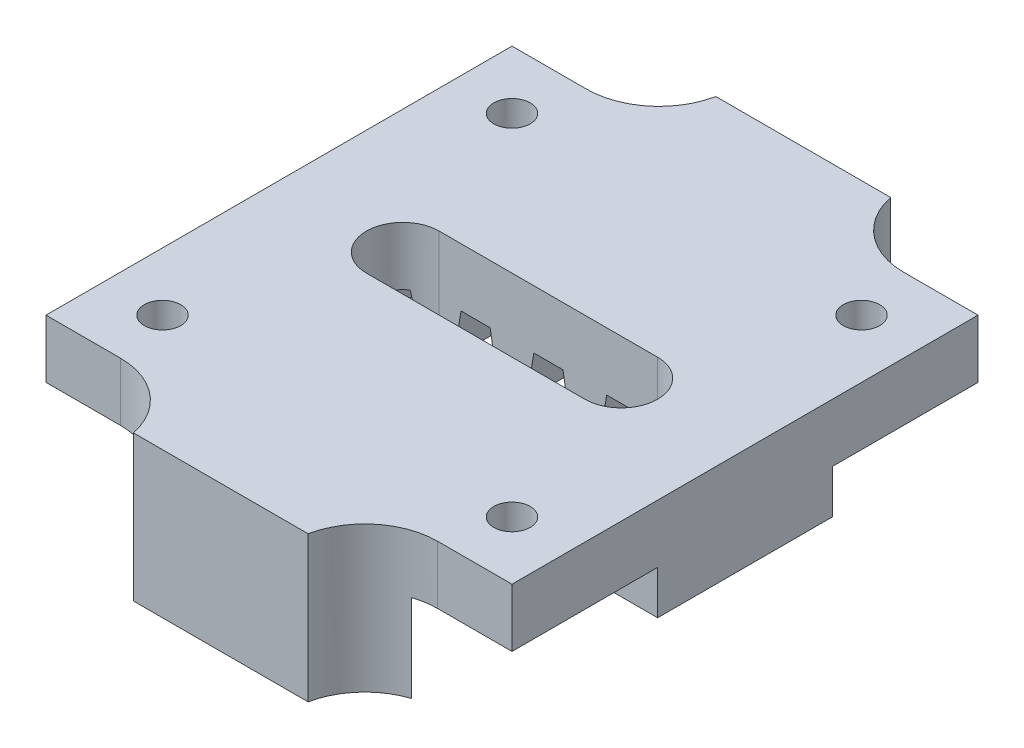
from build123d import *

# Parameters (mm, degrees)
SKETCH_1_W                      = 32
SKETCH_1_H                      = 32
EXTRUDE_1_DEPTH                 = 7
SKETCH_3_R                      = 1.25
CUT_EXTRUDE_1_DEPTH             = 46.793012567
CUT_EXTRUDE_2_DEPTH             = 3
CUT_EXTRUDE_3_DEPTH             = 46.793012567
SKETCH_6_W                      = 12
SKETCH_6_H                      = 10
EXTRUDE_2_DEPTH                 = 4
SKETCH_11_W                     = 12
SKETCH_11_H                     = 3
CUT_EXTRUDE_5_DEPTH             = 0.25
SKETCH_12_W                     = 12
SKETCH_12_H                     = 3
CUT_EXTRUDE_6_DEPTH             = 0.25
CUT_EXTRUDE_7_REACH             = 40.38
CUT_EXTRUDE_7_DIRECTION_2_REACH = 40.38
FILLET_1_R                      = 5
FILLET_2_R                      = 5
CUT_EXTRUDE_8_REACH             = 50.672
SKETCH_13_W                     = 10
SKETCH_13_H                     = 3
CUT_EXTRUDE_9_REACH             = 50.672
SKETCH_14_W                     = 10
SKETCH_14_H                     = 3


with BuildPart() as part:
    # Эскиз1 → Бобышка-Вытянуть1 (new body)
    with BuildSketch(Plane(origin=(0, 0, 0), x_dir=(1, 0, 0), z_dir=(0, 1, 0))):
        with Locations((16, 16)):
            Rectangle(SKETCH_1_W, SKETCH_1_H)
    extrude(amount=EXTRUDE_1_DEPTH)

    # Эскиз3 → Вырез-Вытянуть1 (cut, through all)
    with BuildSketch(Plane(origin=(0, 7, 0), x_dir=(1, 0, 0), z_dir=(0, 1, 0))):
        with Locations(Location((4, 28, 0), (0, 0, 270))):
            Circle(SKETCH_3_R)
        with Locations(Location((28, 28, 0), (0, 0, 270))):
            Circle(SKETCH_3_R)
        with Locations(Location((4, 4, 0), (0, 0, 270))):
            Circle(SKETCH_3_R)
        with Locations(Location((28, 4, 0), (0, 0, 270))):
            Circle(SKETCH_3_R)
    extrude(amount=-CUT_EXTRUDE_1_DEPTH, mode=Mode.SUBTRACT)

    # Эскиз4 → Вырез-Вытянуть2 (cut)
    with BuildSketch(Plane.XZ):
        with BuildLine():
            Line((28, -10), (32, -10))
            Line((32, -10), (32, 0))
            Line((32, 0), (22, 0))
            Line((22, 0), (22, -4))
            ThreePointArc((22, -4), (23.757359313, -8.242640687), (28, -10))
        make_face()
        with BuildLine():
            Line((4, -10), (0, -10))
            Line((0, -10), (0, 0))
            Line((0, 0), (10, 0))
            Line((10, 0), (10, -4))
            ThreePointArc((10, -4), (8.242640687, -8.242640687), (4, -10))
        make_face()
        with BuildLine():
            Line((22, -32), (32, -32))
            Line((32, -32), (32, -22))
            Line((32, -22), (28, -22))
            ThreePointArc((28, -22), (23.757359313, -23.757359313), (22, -28))
            Line((22, -28), (22, -32))
        make_face()
        with BuildLine():
            Line((10, -32), (0, -32))
            Line((0, -32), (0, -22))
            Line((0, -22), (4, -22))
            ThreePointArc((4, -22), (8.242640687, -23.757359313), (10, -28))
            Line((10, -28), (10, -32))
        make_face()
    extrude(amount=-CUT_EXTRUDE_2_DEPTH, mode=Mode.SUBTRACT)

    # Эскиз5 → Вырез-Вытянуть3 (cut, through all)
    with BuildSketch(Plane(origin=(0, 7, 0), x_dir=(1, 0, 0), z_dir=(0, 1, 0))):
        with BuildLine():
            Line((23.5, 18.5), (8.5, 18.5))
            ThreePointArc((8.5, 18.5), (6, 16), (8.5, 13.5))
            Line((8.5, 13.5), (23.5, 13.5))
            ThreePointArc((23.5, 13.5), (26, 16), (23.5, 18.5))
        make_face()
    extrude(amount=-CUT_EXTRUDE_3_DEPTH, mode=Mode.SUBTRACT)

    # Эскиз6 → Бобышка-Вытянуть2 (add)
    with BuildSketch(Plane.XY):
        with Locations((16, 2)):
            Rectangle(SKETCH_6_W, SKETCH_6_H)
    extrude_2 = extrude(amount=EXTRUDE_2_DEPTH)

    # Зеркальное отражение1: Бобышка-Вытянуть2 across plane
    add(extrude_2.mirror(Plane(origin=(0, 0, -16), x_dir=(1, 0, 0), z_dir=(0, 0, -1))))

    # Эскиз11 → Вырез-Вытянуть5 (cut)
    with BuildSketch(Plane(origin=(0, 0, 0), x_dir=(-1, 0, 0), z_dir=(0, 0, -1))):
        with Locations((-16, -1.5)):
            Rectangle(SKETCH_11_W, SKETCH_11_H)
    extrude(amount=-CUT_EXTRUDE_5_DEPTH, mode=Mode.SUBTRACT)

    # Эскиз12 → Вырез-Вытянуть6 (cut)
    with BuildSketch(Plane.XY.offset(-32)):
        with Locations((16, -1.5)):
            Rectangle(SKETCH_12_W, SKETCH_12_H)
    extrude(amount=-CUT_EXTRUDE_6_DEPTH, mode=Mode.SUBTRACT)

    # Вырез-Вытянуть7: up to this face of the body (flat: up to its plane)
    cut_extrude_7_end = Plane(part.part.faces().sort_by_distance((16, -1.5, 0.25))[0])
    # Эскиз10 → Вырез-Вытянуть7 (cut, up to the picked face)
    with BuildSketch(Plane(origin=(0, 0, -16), x_dir=(-1, 0, 0), z_dir=(0, 0, -1)), mode=Mode.PRIVATE) as cut_extrude_7_sk1:
        Polygon((-14.5, 0), (-15, 3), (-17, 3), (-17.5, 0), align=None)
    cut_extrude_7_tool1 = split(extrude(cut_extrude_7_sk1.sketch, amount=-CUT_EXTRUDE_7_REACH, mode=Mode.PRIVATE), bisect_by=cut_extrude_7_end, keep=Keep.BOTH, mode=Mode.PRIVATE)
    # Эскиз10 → Вырез-Вытянуть7 (cut, up to the picked face)
    with BuildSketch(Plane(origin=(0, 0, -16), x_dir=(-1, 0, 0), z_dir=(0, 0, -1)), mode=Mode.PRIVATE) as cut_extrude_7_sk2:
        Polygon((-9.5, 0), (-10, 3), (-12, 3), (-12.5, 0), align=None)
    cut_extrude_7_tool2 = split(extrude(cut_extrude_7_sk2.sketch, amount=-CUT_EXTRUDE_7_REACH, mode=Mode.PRIVATE), bisect_by=cut_extrude_7_end, keep=Keep.BOTH, mode=Mode.PRIVATE)
    # Эскиз10 → Вырез-Вытянуть7 (cut, up to the picked face)
    with BuildSketch(Plane(origin=(0, 0, -16), x_dir=(-1, 0, 0), z_dir=(0, 0, -1)), mode=Mode.PRIVATE) as cut_extrude_7_sk3:
        Polygon((-4.5, 0), (-5, 3), (-7, 3), (-7.5, 0), align=None)
    cut_extrude_7_tool3 = split(extrude(cut_extrude_7_sk3.sketch, amount=-CUT_EXTRUDE_7_REACH, mode=Mode.PRIVATE), bisect_by=cut_extrude_7_end, keep=Keep.BOTH, mode=Mode.PRIVATE)
    # Эскиз10 → Вырез-Вытянуть7 (cut, up to the picked face)
    with BuildSketch(Plane(origin=(0, 0, -16), x_dir=(-1, 0, 0), z_dir=(0, 0, -1)), mode=Mode.PRIVATE) as cut_extrude_7_sk4:
        Polygon((-22.5, 0), (-22, 3), (-20, 3), (-19.5, 0), align=None)
    cut_extrude_7_tool4 = split(extrude(cut_extrude_7_sk4.sketch, amount=-CUT_EXTRUDE_7_REACH, mode=Mode.PRIVATE), bisect_by=cut_extrude_7_end, keep=Keep.BOTH, mode=Mode.PRIVATE)
    # Эскиз10 → Вырез-Вытянуть7 (cut, up to the picked face)
    with BuildSketch(Plane(origin=(0, 0, -16), x_dir=(-1, 0, 0), z_dir=(0, 0, -1)), mode=Mode.PRIVATE) as cut_extrude_7_sk5:
        Polygon((-27.5, 0), (-27, 3), (-25, 3), (-24.5, 0), align=None)
    cut_extrude_7_tool5 = split(extrude(cut_extrude_7_sk5.sketch, amount=-CUT_EXTRUDE_7_REACH, mode=Mode.PRIVATE), bisect_by=cut_extrude_7_end, keep=Keep.BOTH, mode=Mode.PRIVATE)
    add(cut_extrude_7_tool1.solids().sort_by(Axis((16, 1.4, -16), (0, 0, 1)))[0], mode=Mode.SUBTRACT)
    add(cut_extrude_7_tool2.solids().sort_by(Axis((11, 1.4, -16), (0, 0, 1)))[0], mode=Mode.SUBTRACT)
    add(cut_extrude_7_tool3.solids().sort_by(Axis((6, 1.4, -16), (0, 0, 1)))[0], mode=Mode.SUBTRACT)
    add(cut_extrude_7_tool4.solids().sort_by(Axis((21, 1.4, -16), (0, 0, 1)))[0], mode=Mode.SUBTRACT)
    add(cut_extrude_7_tool5.solids().sort_by(Axis((26, 1.4, -16), (0, 0, 1)))[0], mode=Mode.SUBTRACT)

    # Вырез-Вытянуть7 direction 2: up to this face of the body (flat: up to its plane)
    cut_extrude_7_direction_2_end = Plane(part.part.faces().sort_by_distance((16, -1.5, -32.25))[0])
    # Эскиз10 → Вырез-Вытянуть7 direction 2 (cut, up to the picked face)
    with BuildSketch(Plane(origin=(0, 0, -16), x_dir=(-1, 0, 0), z_dir=(0, 0, -1)), mode=Mode.PRIVATE) as cut_extrude_7_direction_2_sk1:
        Polygon((-14.5, 0), (-15, 3), (-17, 3), (-17.5, 0), align=None)
    cut_extrude_7_direction_2_tool1 = split(extrude(cut_extrude_7_direction_2_sk1.sketch, amount=CUT_EXTRUDE_7_DIRECTION_2_REACH, mode=Mode.PRIVATE), bisect_by=cut_extrude_7_direction_2_end, keep=Keep.BOTH, mode=Mode.PRIVATE)
    # Эскиз10 → Вырез-Вытянуть7 direction 2 (cut, up to the picked face)
    with BuildSketch(Plane(origin=(0, 0, -16), x_dir=(-1, 0, 0), z_dir=(0, 0, -1)), mode=Mode.PRIVATE) as cut_extrude_7_direction_2_sk2:
        Polygon((-9.5, 0), (-10, 3), (-12, 3), (-12.5, 0), align=None)
    cut_extrude_7_direction_2_tool2 = split(extrude(cut_extrude_7_direction_2_sk2.sketch, amount=CUT_EXTRUDE_7_DIRECTION_2_REACH, mode=Mode.PRIVATE), bisect_by=cut_extrude_7_direction_2_end, keep=Keep.BOTH, mode=Mode.PRIVATE)
    # Эскиз10 → Вырез-Вытянуть7 direction 2 (cut, up to the picked face)
    with BuildSketch(Plane(origin=(0, 0, -16), x_dir=(-1, 0, 0), z_dir=(0, 0, -1)), mode=Mode.PRIVATE) as cut_extrude_7_direction_2_sk3:
        Polygon((-4.5, 0), (-5, 3), (-7, 3), (-7.5, 0), align=None)
    cut_extrude_7_direction_2_tool3 = split(extrude(cut_extrude_7_direction_2_sk3.sketch, amount=CUT_EXTRUDE_7_DIRECTION_2_REACH, mode=Mode.PRIVATE), bisect_by=cut_extrude_7_direction_2_end, keep=Keep.BOTH, mode=Mode.PRIVATE)
    # Эскиз10 → Вырез-Вытянуть7 direction 2 (cut, up to the picked face)
    with BuildSketch(Plane(origin=(0, 0, -16), x_dir=(-1, 0, 0), z_dir=(0, 0, -1)), mode=Mode.PRIVATE) as cut_extrude_7_direction_2_sk4:
        Polygon((-22.5, 0), (-22, 3), (-20, 3), (-19.5, 0), align=None)
    cut_extrude_7_direction_2_tool4 = split(extrude(cut_extrude_7_direction_2_sk4.sketch, amount=CUT_EXTRUDE_7_DIRECTION_2_REACH, mode=Mode.PRIVATE), bisect_by=cut_extrude_7_direction_2_end, keep=Keep.BOTH, mode=Mode.PRIVATE)
    # Эскиз10 → Вырез-Вытянуть7 direction 2 (cut, up to the picked face)
    with BuildSketch(Plane(origin=(0, 0, -16), x_dir=(-1, 0, 0), z_dir=(0, 0, -1)), mode=Mode.PRIVATE) as cut_extrude_7_direction_2_sk5:
        Polygon((-27.5, 0), (-27, 3), (-25, 3), (-24.5, 0), align=None)
    cut_extrude_7_direction_2_tool5 = split(extrude(cut_extrude_7_direction_2_sk5.sketch, amount=CUT_EXTRUDE_7_DIRECTION_2_REACH, mode=Mode.PRIVATE), bisect_by=cut_extrude_7_direction_2_end, keep=Keep.BOTH, mode=Mode.PRIVATE)
    add(cut_extrude_7_direction_2_tool1.solids().sort_by(Axis((16, 1.4, -16), (0, 0, -1)))[0], mode=Mode.SUBTRACT)
    add(cut_extrude_7_direction_2_tool2.solids().sort_by(Axis((11, 1.4, -16), (0, 0, -1)))[0], mode=Mode.SUBTRACT)
    add(cut_extrude_7_direction_2_tool3.solids().sort_by(Axis((6, 1.4, -16), (0, 0, -1)))[0], mode=Mode.SUBTRACT)
    add(cut_extrude_7_direction_2_tool4.solids().sort_by(Axis((21, 1.4, -16), (0, 0, -1)))[0], mode=Mode.SUBTRACT)
    add(cut_extrude_7_direction_2_tool5.solids().sort_by(Axis((26, 1.4, -16), (0, 0, -1)))[0], mode=Mode.SUBTRACT)

    # Скругление1
    # the kernel refuses this fillet: 5 mm, written as the material it adds along each edge
    with BuildSketch(Plane(origin=(10, -9.247448714, 0), x_dir=(-1, 0, 0), z_dir=(0, 1, 0))) as fillet_1_piece_1_section:
        with BuildLine():
            CenterArc((4.898979486, 5), FILLET_1_R, 191.536959033, 78.463040967)
            Line((0, 4), (-0.09797959, 3.98))
            ThreePointArc((-0.09797959, 3.98), (-0.1, 2), (-0.1, 0))
            Line((-0.1, 0), (0, -0.1))
            Line((0, -0.1), (4.898979486, -0.1))
            Line((4.898979486, -0.1), (4.898979486, 0))
        make_face()
    fillet_1_piece_1 = extrude(amount=16.247448714, mode=Mode.PRIVATE)
    fillet_1_piece_1 = split(fillet_1_piece_1, bisect_by=Plane(origin=(9.174108799, 3, 1.317726135), z_dir=(0, -1, 0)), keep=Keep.TOP, mode=Mode.PRIVATE)
    fillet_1_piece_1 = split(fillet_1_piece_1, bisect_by=Plane(origin=(9.174108799, 0, 0.25), z_dir=(0, 0, 1)), keep=Keep.TOP, mode=Mode.PRIVATE)
    fillet_1_piece_1 = split(fillet_1_piece_1, bisect_by=Plane(origin=(9.174108799, -3, 1.317726135), z_dir=(0, 1, 0)), keep=Keep.TOP, mode=Mode.PRIVATE)
    add(fillet_1_piece_1)
    with BuildSketch(Plane(origin=(10, 3, 0), x_dir=(-1, 0, 0), z_dir=(0, 1, 0))) as fillet_1_piece_2_section:
        with BuildLine():
            CenterArc((4.898979486, 5), FILLET_1_R, 191.536959033, 78.463040967)
            Line((0, 4), (-0.09797959, 3.98))
            ThreePointArc((-0.09797959, 3.98), (-0.1, 2), (-0.1, 0))
            Line((-0.1, 0), (0, -0.1))
            Line((0, -0.1), (4.898979486, -0.1))
            Line((4.898979486, -0.1), (4.898979486, 0))
        make_face()
    fillet_1_piece_2 = extrude(amount=4, mode=Mode.PRIVATE)
    fillet_1_piece_2 = split(fillet_1_piece_2, bisect_by=Plane(origin=(7.929392112, 5, 0.25), z_dir=(0, 0, -1)), keep=Keep.TOP, mode=Mode.PRIVATE)
    add(fillet_1_piece_2)
    with BuildSketch(Plane(origin=(10, 3, 0), x_dir=(-1, 0, 0), z_dir=(0, 1, 0))) as fillet_1_piece_3_section:
        with BuildLine():
            CenterArc((4.898979486, 5), FILLET_1_R, 191.536959033, 78.463040967)
            Line((0, 4), (-0.09797959, 3.98))
            ThreePointArc((-0.09797959, 3.98), (-0.1, 2), (-0.1, 0))
            Line((-0.1, 0), (0, -0.1))
            Line((0, -0.1), (4.898979486, -0.1))
            Line((4.898979486, -0.1), (4.898979486, 0))
        make_face()
    fillet_1_piece_3 = extrude(amount=4, mode=Mode.PRIVATE)
    fillet_1_piece_3 = split(fillet_1_piece_3, bisect_by=Plane(origin=(9.174108799, 5, 0.25), z_dir=(0, 0, 1)), keep=Keep.TOP, mode=Mode.PRIVATE)
    add(fillet_1_piece_3)

    # Скругление2
    # the kernel refuses this fillet: 5 mm, written as the material it adds along each edge
    with BuildSketch(Plane(origin=(10, -9.247448714, -32), x_dir=(-1.5738521597081158e-12, 0, -1.0), z_dir=(0, 1, 0))) as fillet_2_piece_1_section:
        with BuildLine():
            CenterArc((5, 4.898979486), FILLET_2_R, 180, 78.463040967)
            Line((0, 4.898979486), (-0.1, 4.898979486))
            Line((-0.1, 4.898979486), (-0.1, 0))
            Line((-0.1, 0), (0, -0.1))
            ThreePointArc((0, -0.1), (2, -0.1), (3.98, -0.09797959))
            Line((3.98, -0.09797959), (4, 0))
        make_face()
    fillet_2_piece_1 = extrude(amount=16.247448714, mode=Mode.PRIVATE)
    fillet_2_piece_1 = split(fillet_2_piece_1, bisect_by=Plane(origin=(9.174108799, 0, -32.25), z_dir=(0, 0, -1)), keep=Keep.TOP, mode=Mode.PRIVATE)
    fillet_2_piece_1 = split(fillet_2_piece_1, bisect_by=Plane(origin=(9.174108799, 3, -33.317726135), z_dir=(0, -1, 0)), keep=Keep.TOP, mode=Mode.PRIVATE)
    fillet_2_piece_1 = split(fillet_2_piece_1, bisect_by=Plane(origin=(9.174108799, -3, -33.317726135), z_dir=(0, 1, 0)), keep=Keep.TOP, mode=Mode.PRIVATE)
    add(fillet_2_piece_1)
    with BuildSketch(Plane(origin=(10, 3, -32), x_dir=(-1.5720758028687162e-12, 0, -1.0), z_dir=(0, 1, 0))) as fillet_2_piece_2_section:
        with BuildLine():
            CenterArc((5, 4.898979486), FILLET_2_R, 180, 78.463040967)
            Line((0, 4.898979486), (-0.1, 4.898979486))
            Line((-0.1, 4.898979486), (-0.1, 0))
            Line((-0.1, 0), (0, -0.1))
            ThreePointArc((0, -0.1), (2, -0.1), (3.98, -0.09797959))
            Line((3.98, -0.09797959), (4, 0))
        make_face()
    fillet_2_piece_2 = extrude(amount=4, mode=Mode.PRIVATE)
    fillet_2_piece_2 = split(fillet_2_piece_2, bisect_by=Plane(origin=(9.174108799, 5, -32.25), z_dir=(0, 0, -1)), keep=Keep.TOP, mode=Mode.PRIVATE)
    add(fillet_2_piece_2)
    with BuildSketch(Plane(origin=(10, 3, -32), x_dir=(-1.5720758028687162e-12, 0, -1.0), z_dir=(0, 1, 0))) as fillet_2_piece_3_section:
        with BuildLine():
            CenterArc((5, 4.898979486), FILLET_2_R, 180, 78.463040967)
            Line((0, 4.898979486), (-0.1, 4.898979486))
            Line((-0.1, 4.898979486), (-0.1, 0))
            Line((-0.1, 0), (0, -0.1))
            ThreePointArc((0, -0.1), (2, -0.1), (3.98, -0.09797959))
            Line((3.98, -0.09797959), (4, 0))
        make_face()
    fillet_2_piece_3 = extrude(amount=4, mode=Mode.PRIVATE)
    fillet_2_piece_3 = split(fillet_2_piece_3, bisect_by=Plane(origin=(7.929392112, 5, -32.25), z_dir=(0, 0, 1)), keep=Keep.TOP, mode=Mode.PRIVATE)
    add(fillet_2_piece_3)
    with BuildSketch(Plane(origin=(22, 7, -32), x_dir=(1, 0, 0), z_dir=(0, -1, 0))) as fillet_2_piece_4_section:
        with BuildLine():
            CenterArc((4.898979486, -5), FILLET_2_R, 90, 78.463040967)
            Line((0, -4), (-0.09797959, -3.98))
            ThreePointArc((-0.09797959, -3.98), (-0.1, -2), (-0.1, 0))
            Line((-0.1, 0), (0, 0.1))
            Line((0, 0.1), (4.898979486, 0.1))
            Line((4.898979486, 0.1), (4.898979486, 0))
        make_face()
    fillet_2_piece_4 = extrude(amount=4, mode=Mode.PRIVATE)
    fillet_2_piece_4 = split(fillet_2_piece_4, bisect_by=Plane(origin=(24.070607888, 5, -32.25), z_dir=(0, 0, 1)), keep=Keep.TOP, mode=Mode.PRIVATE)
    add(fillet_2_piece_4)
    with BuildSketch(Plane(origin=(22, 7, -32), x_dir=(1, 0, 0), z_dir=(0, -1, 0))) as fillet_2_piece_5_section:
        with BuildLine():
            CenterArc((4.898979486, -5), FILLET_2_R, 90, 78.463040967)
            Line((0, -4), (-0.09797959, -3.98))
            ThreePointArc((-0.09797959, -3.98), (-0.1, -2), (-0.1, 0))
            Line((-0.1, 0), (0, 0.1))
            Line((0, 0.1), (4.898979486, 0.1))
            Line((4.898979486, 0.1), (4.898979486, 0))
        make_face()
    fillet_2_piece_5 = extrude(amount=4, mode=Mode.PRIVATE)
    fillet_2_piece_5 = split(fillet_2_piece_5, bisect_by=Plane(origin=(22.825891201, 5, -32.25), z_dir=(0, 0, -1)), keep=Keep.TOP, mode=Mode.PRIVATE)
    add(fillet_2_piece_5)
    with BuildSketch(Plane(origin=(22, 7, -32), x_dir=(1, 0, 0), z_dir=(0, -1, 0))) as fillet_2_piece_6_section:
        with BuildLine():
            CenterArc((4.898979486, -5), FILLET_2_R, 90, 78.463040967)
            Line((0, -4), (-0.09797959, -3.98))
            ThreePointArc((-0.09797959, -3.98), (-0.1, -2), (-0.1, 0))
            Line((-0.1, 0), (0, 0.1))
            Line((0, 0.1), (4.898979486, 0.1))
            Line((4.898979486, 0.1), (4.898979486, 0))
        make_face()
    fillet_2_piece_6 = extrude(amount=16.247448714, mode=Mode.PRIVATE)
    fillet_2_piece_6 = split(fillet_2_piece_6, bisect_by=Plane(origin=(22.825891201, 3, -33.317726135), z_dir=(0, -1, 0)), keep=Keep.TOP, mode=Mode.PRIVATE)
    fillet_2_piece_6 = split(fillet_2_piece_6, bisect_by=Plane(origin=(22.825891201, -3, -33.317726135), z_dir=(0, 1, 0)), keep=Keep.TOP, mode=Mode.PRIVATE)
    fillet_2_piece_6 = split(fillet_2_piece_6, bisect_by=Plane(origin=(22.825891201, 0, -32.25), z_dir=(0, 0, -1)), keep=Keep.TOP, mode=Mode.PRIVATE)
    add(fillet_2_piece_6)
    with BuildSketch(Plane(origin=(22, 7, 0), x_dir=(1.572075802868717e-12, 0, 1.0), z_dir=(0, -1, 0))) as fillet_2_piece_7_section:
        with BuildLine():
            CenterArc((5, -4.898979486), FILLET_2_R, 101.536959033, 78.463040967)
            Line((0, -4.898979486), (-0.1, -4.898979486))
            Line((-0.1, -4.898979486), (-0.1, 0))
            Line((-0.1, 0), (0, 0.1))
            ThreePointArc((0, 0.1), (2, 0.1), (3.98, 0.09797959))
            Line((3.98, 0.09797959), (4, 0))
        make_face()
    fillet_2_piece_7 = extrude(amount=4, mode=Mode.PRIVATE)
    fillet_2_piece_7 = split(fillet_2_piece_7, bisect_by=Plane(origin=(22.825891201, 5, 0.25), z_dir=(0, 0, 1)), keep=Keep.TOP, mode=Mode.PRIVATE)
    add(fillet_2_piece_7)
    with BuildSketch(Plane(origin=(22, 7, 0), x_dir=(1.572075802868717e-12, 0, 1.0), z_dir=(0, -1, 0))) as fillet_2_piece_8_section:
        with BuildLine():
            CenterArc((5, -4.898979486), FILLET_2_R, 101.536959033, 78.463040967)
            Line((0, -4.898979486), (-0.1, -4.898979486))
            Line((-0.1, -4.898979486), (-0.1, 0))
            Line((-0.1, 0), (0, 0.1))
            ThreePointArc((0, 0.1), (2, 0.1), (3.98, 0.09797959))
            Line((3.98, 0.09797959), (4, 0))
        make_face()
    fillet_2_piece_8 = extrude(amount=4, mode=Mode.PRIVATE)
    fillet_2_piece_8 = split(fillet_2_piece_8, bisect_by=Plane(origin=(24.070607888, 5, 0.25), z_dir=(0, 0, -1)), keep=Keep.TOP, mode=Mode.PRIVATE)
    add(fillet_2_piece_8)
    with BuildSketch(Plane(origin=(22, 7, 0), x_dir=(1.572075802868717e-12, 0, 1.0), z_dir=(0, -1, 0))) as fillet_2_piece_9_section:
        with BuildLine():
            CenterArc((5, -4.898979486), FILLET_2_R, 101.536959033, 78.463040967)
            Line((0, -4.898979486), (-0.1, -4.898979486))
            Line((-0.1, -4.898979486), (-0.1, 0))
            Line((-0.1, 0), (0, 0.1))
            ThreePointArc((0, 0.1), (2, 0.1), (3.98, 0.09797959))
            Line((3.98, 0.09797959), (4, 0))
        make_face()
    fillet_2_piece_9 = extrude(amount=16.247448714, mode=Mode.PRIVATE)
    fillet_2_piece_9 = split(fillet_2_piece_9, bisect_by=Plane(origin=(22.825891201, -3, 1.317726135), z_dir=(0, 1, 0)), keep=Keep.TOP, mode=Mode.PRIVATE)
    fillet_2_piece_9 = split(fillet_2_piece_9, bisect_by=Plane(origin=(22.825891201, 0, 0.25), z_dir=(0, 0, 1)), keep=Keep.TOP, mode=Mode.PRIVATE)
    fillet_2_piece_9 = split(fillet_2_piece_9, bisect_by=Plane(origin=(22.825891201, 3, 1.317726135), z_dir=(0, -1, 0)), keep=Keep.TOP, mode=Mode.PRIVATE)
    add(fillet_2_piece_9)

    # Вырез-Вытянуть8: up to this face of the body (flat: up to its plane)
    cut_extrude_8_end = Plane(part.part.faces().sort_by_distance((12.25, 1.5, -6.625))[0])
    # Эскиз13 → Вырез-Вытянуть8 (cut, up to the picked face)
    with BuildSketch(Plane.ZY, mode=Mode.PRIVATE) as cut_extrude_8_sk1:
        with Locations((-5, 1.5)):
            Rectangle(SKETCH_13_W, SKETCH_13_H)
    cut_extrude_8_tool1 = split(extrude(cut_extrude_8_sk1.sketch, amount=-CUT_EXTRUDE_8_REACH, mode=Mode.PRIVATE), bisect_by=cut_extrude_8_end, keep=Keep.BOTH, mode=Mode.PRIVATE)
    cut_extrude_8 = cut_extrude_8_tool1.solids().sort_by(Axis((0, 1.5, -5), (1, 0, 0)))[0]
    add(cut_extrude_8, mode=Mode.SUBTRACT)

    # Вырез-Вытянуть9: up to this plane
    cut_extrude_9_end = Plane(origin=(22.5, 0, 4.492640687), z_dir=(0.9863939238321437, 0.16439898730535746, 0))
    # Эскиз14 → Вырез-Вытянуть9 (cut, up to the surface)
    with BuildSketch(Plane(origin=(32, 0, 0), x_dir=(0, 0, -1), z_dir=(1, 0, 0)), mode=Mode.PRIVATE) as cut_extrude_9_sk1:
        with Locations((5, 1.5)):
            Rectangle(SKETCH_14_W, SKETCH_14_H)
    cut_extrude_9_tool1 = split(extrude(cut_extrude_9_sk1.sketch, amount=-CUT_EXTRUDE_9_REACH, mode=Mode.PRIVATE), bisect_by=cut_extrude_9_end, keep=Keep.BOTH, mode=Mode.PRIVATE)
    cut_extrude_9 = cut_extrude_9_tool1.solids().sort_by_distance((32, 1.5, -5))[0]
    add(cut_extrude_9, mode=Mode.SUBTRACT)

    # Зеркальное отражение2: Вырез-Вытянуть8, Вырез-Вытянуть9 across plane
    add(cut_extrude_8.mirror(Plane(origin=(0, 0, -16), x_dir=(1, 0, 0), z_dir=(0, 0, -1))), mode=Mode.SUBTRACT)
    add(cut_extrude_9.mirror(Plane(origin=(0, 0, -16), x_dir=(1, 0, 0), z_dir=(0, 0, -1))), mode=Mode.SUBTRACT)


solid = part.part
